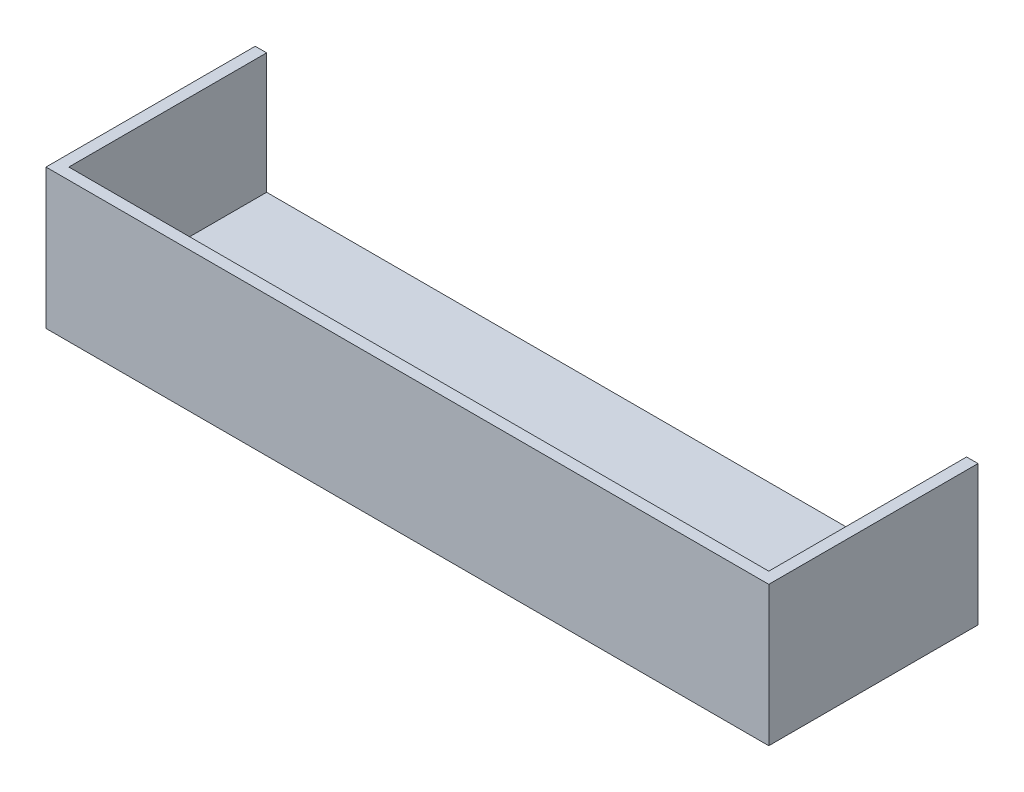
from build123d import *

# Parameters (mm, degrees)
BOSS_EXTRUDE1_DEPTH = 31.75
SKETCH2_W           = 190
SKETCH2_H           = 55
BOSS_EXTRUDE2_DEPTH = 5


with BuildPart() as part:
    # Sketch1 → Boss-Extrude1 (new body)
    with BuildSketch(Plane(origin=(0, 0, 0), x_dir=(1, 0, 0), z_dir=(0, 1, 0))):
        Polygon((0, 55), (3, 55.001332802), (3, 3), (187, 3), (187, 55.001332802), (190, 55), (190, 0), (0, 0), align=None)
    extrude(amount=BOSS_EXTRUDE1_DEPTH)

    # Sketch2 → Boss-Extrude2 (add)
    with BuildSketch(Plane.XZ):
        with Locations((95, -27.5)):
            Rectangle(SKETCH2_W, SKETCH2_H)
    extrude(amount=BOSS_EXTRUDE2_DEPTH)


solid = part.part
